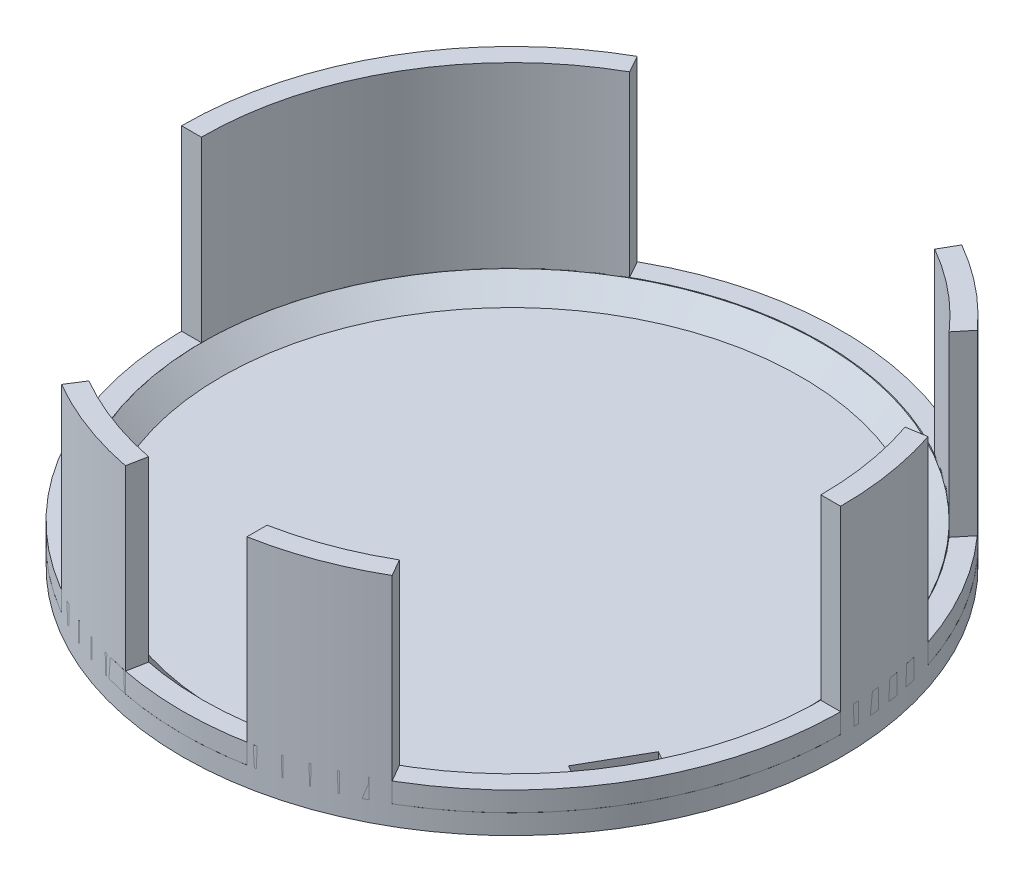
from build123d import *

# Parameters (mm, degrees)
SKETCH1_R               = 25
BOSS_EXTRUDE1_DEPTH     = 1.5
BOSS_EXTRUDE2_DEPTH     = 15
CUT_EXTRUDE3_DEPTH      = 15
CUT_EXTRUDE3_DEPTH_BACK = 0.001
CUT_EXTRUDE4_DEPTH      = 5.001
SKETCH9_R               = 25
SKETCH9_R_2             = 23.5
BOSS_EXTRUDE4_DEPTH     = 1.5
CUT_EXTRUDE5_DEPTH      = 4.5


with BuildPart() as part:
    # Sketch1 → Boss-Extrude1 (new body)
    with BuildSketch(Plane(origin=(0, 0, 0), x_dir=(1, 0, 0), z_dir=(0, 1, 0))):
        Circle(SKETCH1_R)
    extrude(amount=BOSS_EXTRUDE1_DEPTH)

    # Sketch3 → Boss-Extrude2 (add)
    with BuildSketch(Plane(origin=(0, 1.5, 0), x_dir=(1, 0, 0), z_dir=(0, 1, 0))):
        with BuildLine():
            ThreePointArc((25, 0), (-10.270047641, 22.793115659), (-16.562089716, -18.726910696))
            ThreePointArc((-16.562089716, -18.726910696), (10.270047641, -22.793115659), (25, 0))
        make_face()
        with BuildLine():
            ThreePointArc((23.5, 0), (9.653844782, -21.42552872), (-15.568364333, -17.603296054))
            ThreePointArc((-15.568364333, -17.603296054), (-9.653844782, 21.42552872), (23.5, 0))
        make_face(mode=Mode.SUBTRACT)
    extrude(amount=BOSS_EXTRUDE2_DEPTH)

    # Sketch4 → Cut-Extrude3 (cut, two sides: drawn at the far end of the back side and taken through both)
    with BuildSketch(Plane(origin=(0, 1.5, 0), x_dir=(1, 0, 0), z_dir=(0, 1, 0)).offset(-CUT_EXTRUDE3_DEPTH_BACK)):
        with BuildLine():
            Line((11.784714356, -20.331515132), (12.536930166, -21.629271417))
            ThreePointArc((12.536930166, -21.629271417), (21.64452184, -12.510582494), (24.999909933, -0.067106913))
            Line((24.999909933, -0.067106913), (23.499904184, -0.067106913))
            ThreePointArc((23.499904184, -0.067106913), (20.344842995, -11.761690504), (11.784714356, -20.331515132))
        make_face()
        with BuildLine():
            ThreePointArc((-4.796569027, -24.535544126), (-0.158926829, -24.99949484), (4.48423915, -24.594544095))
            Line((4.48423915, -24.594544095), (4.48423915, -23.068194538))
            ThreePointArc((4.48423915, -23.068194538), (-0.0124988, -23.499996676), (-4.508774886, -23.063411479))
            Line((-4.508774886, -23.063411479), (-4.796569027, -24.535544126))
        make_face()
        with BuildLine():
            ThreePointArc((-24.999909933, -0.067106913), (-21.650665798, -12.49994682), (-12.558177453, -21.616941945))
            Line((-12.558177453, -21.616941945), (-11.753909653, -20.349339249))
            ThreePointArc((-11.753909653, -20.349339249), (-20.335930877, -11.777092823), (-23.499904184, -0.067106913))
            Line((-23.499904184, -0.067106913), (-24.999909933, -0.067106913))
        make_face()
        with BuildLine():
            Line((22.244801118, 7.577520917), (23.743699089, 7.825391591))
            ThreePointArc((23.743699089, 7.825391591), (21.640227627, 12.518008956), (18.621106201, 16.680959321))
            Line((18.621106201, 16.680959321), (17.658496176, 15.505725162))
            ThreePointArc((17.658496176, 15.505725162), (20.341641757, 11.767226123), (22.244801118, 7.577520917))
        make_face()
        with BuildLine():
            ThreePointArc((12.42188042, 21.695549931), (0.082599021, 24.999863548), (-12.27824751, 21.777158632))
            Line((-12.27824751, 21.777158632), (-11.541552659, 20.470529114))
            ThreePointArc((-11.541552659, 20.470529114), (0.07764308, 23.499871735), (11.676567595, 20.393816936))
            Line((11.676567595, 20.393816936), (12.42188042, 21.695549931))
        make_face()
    extrude(amount=CUT_EXTRUDE3_DEPTH + CUT_EXTRUDE3_DEPTH_BACK, mode=Mode.SUBTRACT)

    # Sketch5 → Cut-Extrude4 (cut)
    with BuildSketch(Plane.XZ):
        Polygon((16.733709956, 12.446973803), (19.216503445, 8.104071987), (20.960461392, 9.101075286), (18.477667903, 13.443977102), align=None)
    extrude(amount=-CUT_EXTRUDE4_DEPTH, mode=Mode.SUBTRACT)


with BuildPart() as body_2:
    # Sketch8 → Revolve4 (revolve)
    with BuildSketch(Plane.XY.offset(0.067106913)):
        Polygon((-23.499904184, 3), (-23.499904184, 1.5), (-21.999904184, 1.5), align=None)
    revolve(axis=Axis((0, 0, 0.067106913), (0, 1, 0)))

    # Sketch10 → Cut-Extrude5 (cut)
    with BuildSketch(Plane.XZ):
        Polygon((19.216503445, 8.104071987), (20.960461392, 9.101075286), (18.477667903, 13.443977102), (16.733709956, 12.446973803), align=None)
    extrude(amount=-CUT_EXTRUDE5_DEPTH, mode=Mode.SUBTRACT)


with BuildPart() as body_3:
    # Sketch9 → Boss-Extrude4 (new body)
    with BuildSketch(Plane(origin=(0, 1.5, 0), x_dir=(1, 0, 0), z_dir=(0, 1, 0))):
        Circle(SKETCH9_R)
        Circle(SKETCH9_R_2, mode=Mode.SUBTRACT)
    extrude(amount=BOSS_EXTRUDE4_DEPTH)


solid = Compound([part.part, body_2.part, body_3.part])
